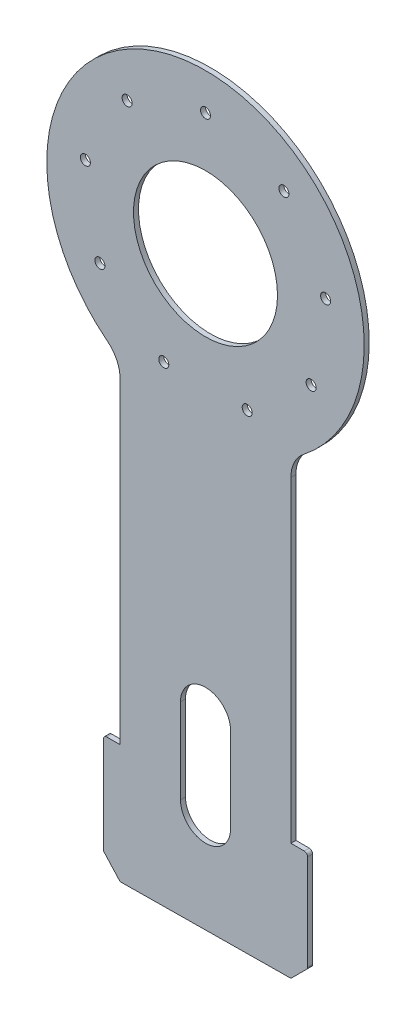
from build123d import *

# Parameters (mm, degrees)
SKETCH1_R             = 47.5
SKETCH1_R_2           = 21.55
BOSS_EXTRUDE1_DEPTH   = 1.5
F_3_0MM_DOWEL_HOLE1_D = 3
CIRPATTERN1_COUNT     = 9
BOSS_EXTRUDE2_DEPTH   = 1.5
FILLET7_R             = 10
FILLET8_R             = 10
FILLET9_R             = 1
FILLET10_R            = 1
CUT_EXTRUDE2_DEPTH    = 1.5


with BuildPart() as part:
    # Sketch1 → Boss-Extrude1 (new body)
    with BuildSketch(Plane.XY):
        Circle(SKETCH1_R)
        Circle(SKETCH1_R_2, mode=Mode.SUBTRACT)
    extrude(amount=BOSS_EXTRUDE1_DEPTH)

    # Ø3.0mm Dowel Hole1 (through all)
    with Locations(Plane.XY.offset(1.5)):
        with Locations((0, 36.5)):
            f_3_0mm_dowel_hole1 = Hole(F_3_0MM_DOWEL_HOLE1_D / 2)

    # CirPattern1: Ø3.0mm Dowel Hole1 ×9 about axis
    cirpattern1_axis = Axis((0, 0, 1.5), (0, 0, 1))
    for i in range(1, CIRPATTERN1_COUNT):
        add(f_3_0mm_dowel_hole1.rotate(cirpattern1_axis, i * 360 / CIRPATTERN1_COUNT), mode=Mode.SUBTRACT)

    # Sketch6 → Boss-Extrude2 (add)
    with BuildSketch(Plane.XY.offset(1.5)):
        Polygon((-25.563438214, -40.034492962), (25.563438214, -40.034492962), (25.563438214, -140.034492962), (30.563438214, -140.034492962), (30.563438214, -170.034492962), (25.563438214, -175.034492962), (-25.563438214, -175.5367607), (-30.563438214, -170.034492962), (-30.563438214, -140.034492962), (-25.563438214, -140.034492962), align=None)
    extrude(amount=-BOSS_EXTRUDE2_DEPTH)

    # Fillet7
    fillet7_edges = [part.edges().sort_by_distance(p)[0] for p in [
        (-25.563438214, -40.034492962, 0.75),
    ]]
    fillet(fillet7_edges, radius=FILLET7_R)

    # Fillet8
    fillet8_edges = [part.edges().sort_by_distance(p)[0] for p in [
        (25.563438214, -40.034492962, 0.75),
    ]]
    fillet(fillet8_edges, radius=FILLET8_R)

    # Fillet9
    fillet9_edges = [part.edges().sort_by_distance(p)[0] for p in [
        (-30.563438214, -140.034492962, 0.75),
        (30.563438214, -140.034492962, 0.75),
    ]]
    fillet(fillet9_edges, radius=FILLET9_R)

    # Fillet10
    fillet10_edges = [part.edges().sort_by_distance(p)[0] for p in [
        (-30.563438214, -170.034492962, 0.75),
        (-25.563438214, -175.5367607, 0.75),
        (25.563438214, -175.034492962, 0.75),
        (30.563438214, -170.034492962, 0.75),
    ]]
    fillet(fillet10_edges, radius=FILLET10_R)

    # Sketch8 → Cut-Extrude2 (cut)
    with BuildSketch(Plane(origin=(0, 0, 0), x_dir=(-1, 0, 0), z_dir=(0, 0, -1))):
        with BuildLine():
            Line((-7.519953185, -145.285430812), (-7.519953185, -119.885430812))
            ThreePointArc((-7.519953185, -119.885430812), (-0.019953185, -112.385430812), (7.480046815, -119.885430812))
            Line((7.480046815, -119.885430812), (7.480046815, -145.285430812))
            ThreePointArc((7.480046815, -145.285430812), (-0.019953185, -152.785430812), (-7.519953185, -145.285430812))
        make_face()
    extrude(amount=-CUT_EXTRUDE2_DEPTH, mode=Mode.SUBTRACT)


solid = part.part
